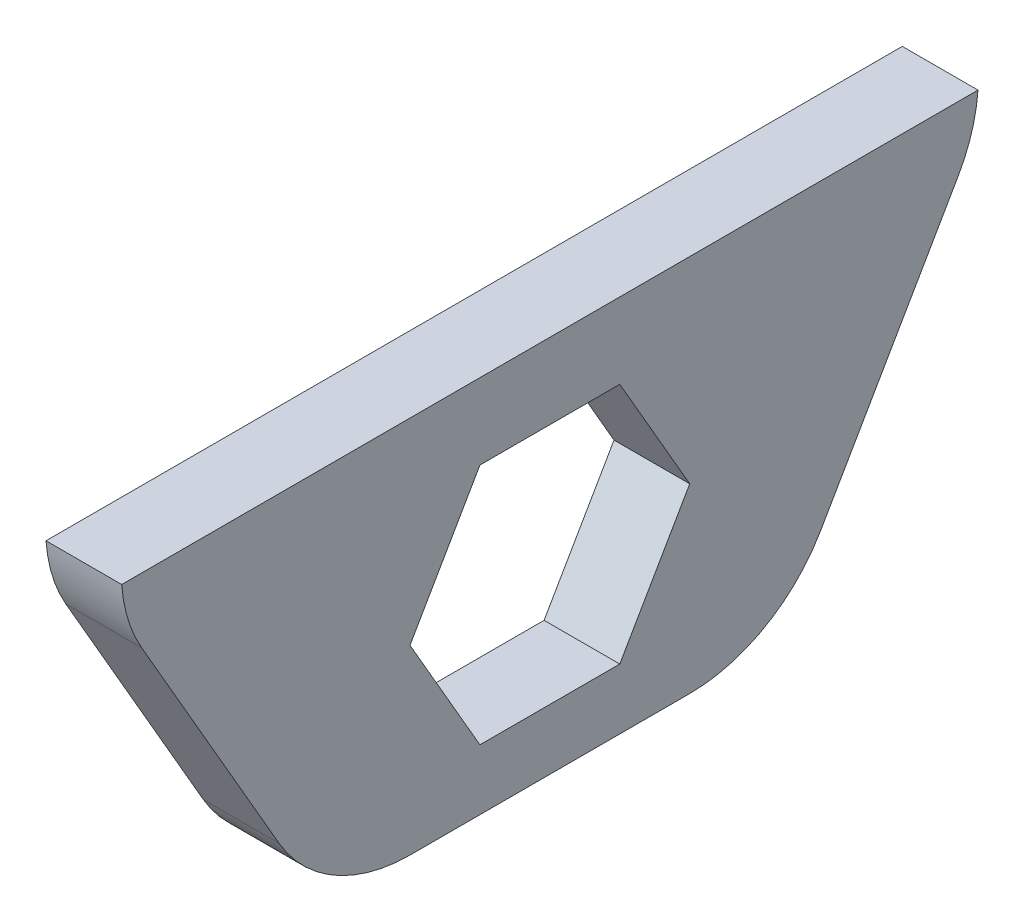
from build123d import *

# Parameters (mm, degrees)
EXTRUDE_1_DEPTH     = 5
FILLET_1_R          = 10
CUT_EXTRUDE_1_DEPTH = 10


with BuildPart() as part:
    # 스케치1 → 보스-돌출1 (new body)
    with BuildSketch(Plane(origin=(0, 0, 0), x_dir=(0, 0, -1), z_dir=(1, 0, 0))):
        Polygon((0, 0), (-13.279056191, 23), (-13.279056191, 25), (43.279056191, 25), (43.279056191, 23), (30, 0), align=None)
    extrude(amount=EXTRUDE_1_DEPTH)

    # 필렛1
    # the kernel refuses this fillet: 10 mm, written as the material it takes off along each edge
    with BuildSketch(Plane(origin=(-6.56712034, 23, -43.279056191), x_dir=(0, 1, 0), z_dir=(1, 0, 0))) as fillet_1_piece_1:
        with BuildLine():
            CenterArc((2.725082782, 9.973678106), FILLET_1_R, 240, 25.841932763)
            Line((-2.274917218, 1.313424068), (-2.374917218, 1.140218987))
            Line((-2.374917218, 1.140218987), (-0.1, -0.173205081))
            Line((-0.1, -0.173205081), (0, -0.2))
            ThreePointArc((0, -0.2), (1, -0.2), (1.985498344, -0.199473562))
            Line((1.985498344, -0.199473562), (2, 0))
        make_face()
    extrude(amount=18.13424068, mode=Mode.SUBTRACT)
    with BuildSketch(Plane(origin=(-14.43375673, 0, -30), x_dir=(0, 0.8660254037844399, -0.499999999999998), z_dir=(1, 0, 0))) as fillet_1_piece_2:
        with BuildLine():
            CenterArc((FILLET_1_R * 0.57735026919, FILLET_1_R), FILLET_1_R, 210, 60)
            Line((-FILLET_1_R * 0.288675134595, FILLET_1_R * 0.5), (-FILLET_1_R * 0.305995642671, FILLET_1_R * 0.49))
            Line((-FILLET_1_R * 0.305995642671, FILLET_1_R * 0.49), (-FILLET_1_R * 0.0115470053838, -FILLET_1_R * 0.02))
            Line((-FILLET_1_R * 0.0115470053838, -FILLET_1_R * 0.02), (FILLET_1_R * 0.57735026919, -FILLET_1_R * 0.02))
            Line((FILLET_1_R * 0.57735026919, -FILLET_1_R * 0.02), (FILLET_1_R * 0.57735026919, 0))
        make_face()
    extrude(amount=33.867513459, mode=Mode.SUBTRACT)
    with BuildSketch(Plane(origin=(-14.43375673, 0, 0), x_dir=(0, 0.8660254037844397, 0.49999999999999833), z_dir=(1, 0, 0))) as fillet_1_piece_3:
        with BuildLine():
            CenterArc((FILLET_1_R * 0.57735026919, -FILLET_1_R), FILLET_1_R, 90, 60)
            Line((-FILLET_1_R * 0.288675134595, -FILLET_1_R * 0.5), (-FILLET_1_R * 0.305995642671, -FILLET_1_R * 0.49))
            Line((-FILLET_1_R * 0.305995642671, -FILLET_1_R * 0.49), (-FILLET_1_R * 0.0115470053838, FILLET_1_R * 0.02))
            Line((-FILLET_1_R * 0.0115470053838, FILLET_1_R * 0.02), (FILLET_1_R * 0.57735026919, FILLET_1_R * 0.02))
            Line((FILLET_1_R * 0.57735026919, FILLET_1_R * 0.02), (FILLET_1_R * 0.57735026919, 0))
        make_face()
    extrude(amount=33.867513459, mode=Mode.SUBTRACT)
    with BuildSketch(Plane(origin=(-6.56712034, 23, 13.279056191), x_dir=(0, -0.8660254037844397, -0.4999999999999979), z_dir=(1, 0, 0))) as fillet_1_piece_4:
        with BuildLine():
            CenterArc((2.626848136, 10), FILLET_1_R, 244.158067237, 25.841932763)
            Line((-1.732050808, 1), (-1.819228786, 0.82))
            ThreePointArc((-1.819228786, 0.82), (-0.966025404, 0.326794919), (-0.1, -0.173205081))
            Line((-0.1, -0.173205081), (0, -0.2))
            Line((0, -0.2), (2.626848136, -0.2))
            Line((2.626848136, -0.2), (2.626848136, 0))
        make_face()
    extrude(amount=18.13424068, mode=Mode.SUBTRACT)

    # 스케치2 → 컷-돌출1 (cut)
    with BuildSketch(Plane(origin=(5, 0, 0), x_dir=(0, 0, -1), z_dir=(1, 0, 0))):
        Polygon((19.618802154, 20), (10.381197846, 20), (5.762395693, 12), (10.381197846, 4), (19.618802154, 4), (24.237604307, 12), align=None)
    extrude(amount=-CUT_EXTRUDE_1_DEPTH, mode=Mode.SUBTRACT)


solid = part.part
